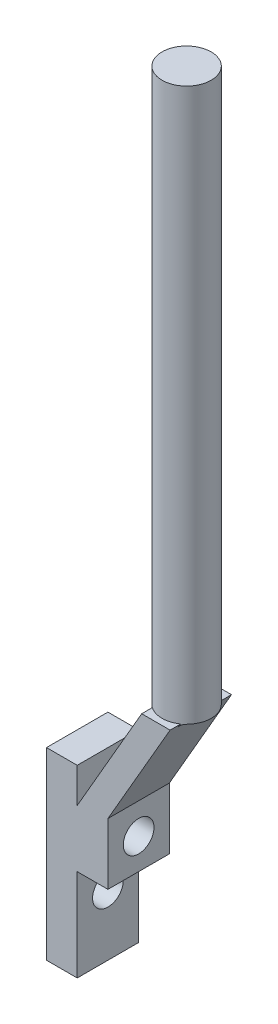
from build123d import *

# Parameters (mm, degrees)
BASE_DEPTH      = 10
ESQUISSE3_R     = 2.5
VIDE_TROU_DEPTH = 10
ESQUISSE4_R     = 4
AXE_DEPTH       = 90
CONG_5_R        = 1


with BuildPart() as part:
    # Esquisse2 → BASE (new body)
    with BuildSketch(Plane.XY):
        Polygon((-7.689490084, -15), (-2.689490084, -15), (-2.689490084, 0), (2.310509916, 0), (2.310509916, 9.990381057), (12.432116189, 27.521517376), (7.813314036, 27.521517376), (-2.689490084, 9.330127019), (-2.689490084, 15), (-7.689490084, 15), align=None)
    extrude(amount=BASE_DEPTH)

    # Esquisse3 → VIDE TROU (cut)
    with BuildSketch(Plane.ZY.offset(7.689490084)):
        with Locations((5, 5)):
            Circle(ESQUISSE3_R)
        with Locations((5, -5)):
            Circle(ESQUISSE3_R)
    extrude(amount=-VIDE_TROU_DEPTH, mode=Mode.SUBTRACT)

    # Esquisse4 → AXE (add)
    with BuildSketch(Plane(origin=(0, 27.521517376, 0), x_dir=(1, 0, 0), z_dir=(0, 1, 0))):
        with Locations(Location((10.122715113, -5, 0), (0, 0, 54.735610317))):
            Circle(ESQUISSE4_R)
    extrude(amount=AXE_DEPTH)

    # Congé5
    # the kernel refuses this fillet: 1 mm, written as the material it adds along each edge
    with BuildSketch(Plane(origin=(7.813314036, 27.521517376, -2.596113343), x_dir=(-0.500000000000004, -0.8660254037844363, 0), z_dir=(0, 0, 1))) as cong_5_piece_1_section:
        with BuildLine():
            CenterArc((CONG_5_R * 1.73205080757, -CONG_5_R), CONG_5_R, 90, 120)
            Line((CONG_5_R * 0.866025403784, -CONG_5_R * 1.5), (0, 0))
            Line((0, 0), (CONG_5_R * 1.73205080757, 0))
        make_face()
    cong_5_piece_1 = extrude(amount=15.192226685, mode=Mode.PRIVATE)
    cong_5_piece_1 = cong_5_piece_1 & Plane(origin=(10.122715113, 27.147514767, 5), x_dir=(0.577350269193122, 0, -0.8164965809252538), z_dir=(0, -1, 0)) * Cylinder(4, 38, mode=Mode.PRIVATE)
    add(cong_5_piece_1)
    with BuildSketch(Plane(origin=(12.432116189, 27.521517376, 0.290638003), x_dir=(-0.500000000000006, -0.8660254037844353, 0), z_dir=(0, 0, 1))) as cong_5_piece_2_section:
        with BuildLine():
            CenterArc((CONG_5_R * 0.57735026919, CONG_5_R), CONG_5_R, 210, 60)
            Line((-CONG_5_R * 0.288675134595, CONG_5_R * 0.5), (0, 0))
            Line((0, 0), (CONG_5_R * 0.57735026919, 0))
        make_face()
    cong_5_piece_2 = extrude(amount=9.418723993, mode=Mode.PRIVATE)
    cong_5_piece_2 = cong_5_piece_2 & Plane(origin=(10.122715113, 27.414246349, 5), x_dir=(0.577350269193122, 0, -0.8164965809252538), z_dir=(0, -1, 0)) * Cylinder(4, 22, mode=Mode.PRIVATE)
    add(cong_5_piece_2)


solid = part.part
